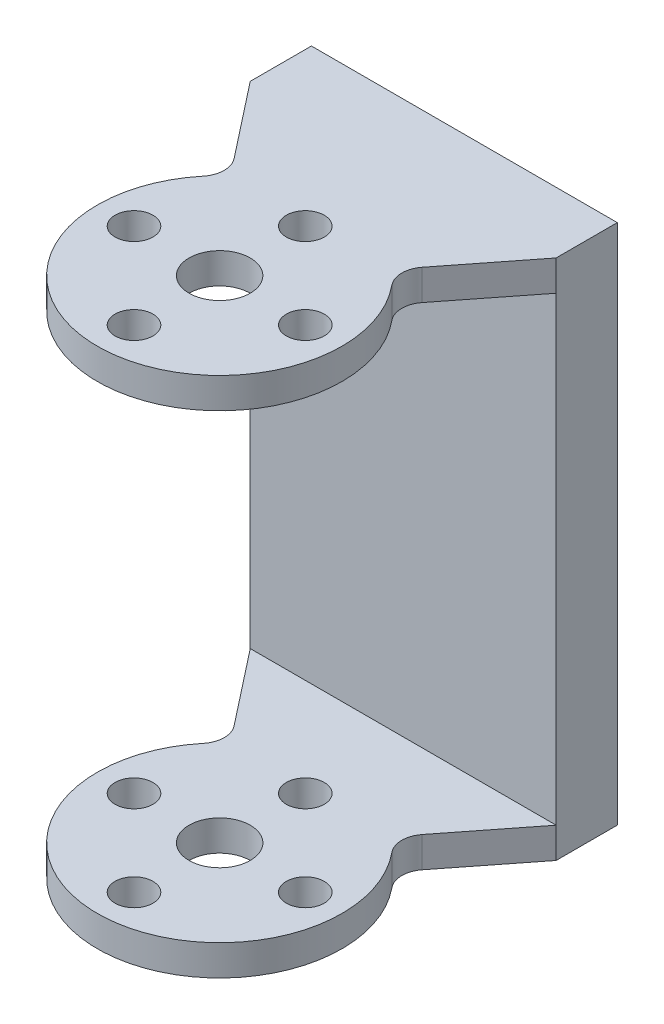
from build123d import *

# Parameters (mm, degrees)
SKETCH1_R           = 2.5
BOSS_EXTRUDE1_DEPTH = 42.65
SKETCH2_W           = 40
SKETCH2_H           = 37.65
CUT_EXTRUDE1_DEPTH  = 54.329377457
SKETCH3_R           = 1.55
CUT_EXTRUDE2_DEPTH  = 49.736767435
CIRPATTERN1_COUNT   = 4
FILLET1_R           = 2


with BuildPart() as part:
    # Sketch1 → Boss-Extrude1 (new body)
    with BuildSketch(Plane(origin=(0, 0, 0), x_dir=(1, 0, 0), z_dir=(0, 1, 0))):
        with BuildLine():
            Line((-12.5, 15), (-12.5, 20))
            Line((-12.5, 20), (12.5, 20))
            Line((12.5, 20), (12.5, 15))
            Line((12.5, 15), (6.614378278, 7.5))
            ThreePointArc((6.614378278, 7.5), (0, -10), (-6.614378278, 7.5))
            Line((-6.614378278, 7.5), (-12.5, 15))
        make_face()
        Circle(SKETCH1_R, mode=Mode.SUBTRACT)
    extrude(amount=BOSS_EXTRUDE1_DEPTH)

    # Sketch2 → Cut-Extrude1 (cut, through all)
    with BuildSketch(Plane.ZY.offset(12.5)):
        with Locations((5, 21.325)):
            Rectangle(SKETCH2_W, SKETCH2_H)
    extrude(amount=-CUT_EXTRUDE1_DEPTH, mode=Mode.SUBTRACT)

    # Sketch3 → Cut-Extrude2 (cut, through all)
    with BuildSketch(Plane(origin=(0, 42.65, 0), x_dir=(1, 0, 0), z_dir=(0, 1, 0))):
        with Locations((0, 7)):
            Circle(SKETCH3_R)
    cut_extrude2 = extrude(amount=-CUT_EXTRUDE2_DEPTH, mode=Mode.SUBTRACT)

    # CirPattern1: Cut-Extrude2 ×4 about axis
    cirpattern1_axis = Axis((0, 42.65, 0), (0, -1, 0))
    for i in range(1, CIRPATTERN1_COUNT):
        add(cut_extrude2.rotate(cirpattern1_axis, i * 360 / CIRPATTERN1_COUNT), mode=Mode.SUBTRACT)

    # Fillet1
    fillet1_edges = [part.edges().sort_by_distance(p)[0] for p in [
        (6.614378278, 41.4, -7.5),
        (6.614378278, 1.25, -7.5),
        (-6.614378278, 41.4, -7.5),
        (-6.614378278, 1.25, -7.5),
    ]]
    fillet(fillet1_edges, radius=FILLET1_R)


solid = part.part
